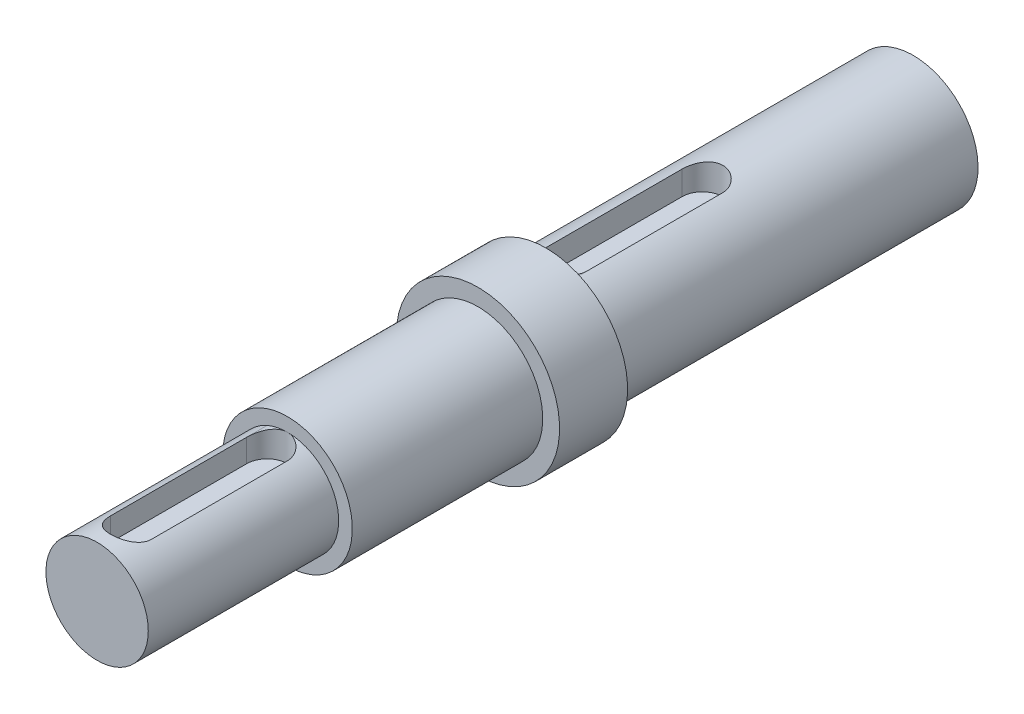
from build123d import *

# Parameters (mm, degrees)
SKETCH1_R               = 3.7625
PART1_DEPTH             = 14
SKETCH3_W               = 3
SKETCH3_H               = 4
KEYWAY1_DEPTH           = 13
SKETCH4_R               = 4.7625
PART2_BALLBEARING_DEPTH = 14
KEYWAY1_A_R             = 1.5
KEYWAY1_B_R             = 1.5
SKETCH6_R               = 6
PART3_DEPTH             = 5
SKETCH7_R               = 4.7625
PART4_DEPTH             = 13
SKETCH8_W               = 3
SKETCH8_H               = 4
KEYWAY2_DEPTH           = 13
SKETCH9_R               = 4.7625
PART5_BALLBEARING_DEPTH = 14
FILLET1_R               = 1.5
FILLET2_R               = 1.5


# Some blends are built 0.0001 mm under size
with BuildPart() as part:
    # Sketch1 → Part1 (new body)
    with BuildSketch(Plane.XY):
        Circle(SKETCH1_R)
    extrude(amount=PART1_DEPTH)

    # Sketch3 → Keyway1 (cut)
    with BuildSketch(Plane(origin=(0, 0, 0), x_dir=(-1, 0, 0), z_dir=(0, 0, -1))):
        with Locations((0, 3.7625)):
            Rectangle(SKETCH3_W, SKETCH3_H)
    extrude(amount=-KEYWAY1_DEPTH, mode=Mode.SUBTRACT)

    # Sketch4 → Part2_BallBearing (add)
    with BuildSketch(Plane(origin=(0, 0, 0), x_dir=(-1, 0, 0), z_dir=(0, 0, -1))):
        Circle(SKETCH4_R)
    extrude(amount=PART2_BALLBEARING_DEPTH)

    # Keyway1_a
    # the kernel refuses this fillet: 1.5 mm, written as the material it adds along each edge
    with BuildSketch(Plane(origin=(1.5, -1.9875, 0), x_dir=(-1, 0, 0), z_dir=(0, 1, 0))) as keyway1_a_piece_1_section:
        with BuildLine():
            CenterArc((KEYWAY1_A_R, KEYWAY1_A_R), KEYWAY1_A_R, 180, 90)
            Line((0, KEYWAY1_A_R), (0, 0))
            Line((0, 0), (KEYWAY1_A_R, 0))
        make_face()
    keyway1_a_piece_1 = extrude(amount=9.188066, mode=Mode.PRIVATE)
    keyway1_a_piece_1 = keyway1_a_piece_1 & Plane(origin=(0, 0, 0.327266), x_dir=(1, 0, 0), z_dir=(0, 0, -1)) * Cylinder(3.7625, 25, mode=Mode.PRIVATE)
    add(keyway1_a_piece_1)
    with BuildSketch(Plane(origin=(-1.5, 7.200566, 0), x_dir=(1, 0, 0), z_dir=(0, -1, 0))) as keyway1_a_piece_2_section:
        with BuildLine():
            CenterArc((KEYWAY1_A_R, KEYWAY1_A_R), KEYWAY1_A_R, 180, 90)
            Line((0, KEYWAY1_A_R), (0, 0))
            Line((0, 0), (KEYWAY1_A_R, 0))
        make_face()
    keyway1_a_piece_2 = extrude(amount=9.188066, mode=Mode.PRIVATE)
    keyway1_a_piece_2 = keyway1_a_piece_2 & Plane(origin=(0, 0, 0.327266), x_dir=(1, 0, 0), z_dir=(0, 0, -1)) * Cylinder(3.7625, 25, mode=Mode.PRIVATE)
    add(keyway1_a_piece_2)

    # Keyway1_b
    keyway1_b_edges = [part.edges().sort_by_distance(p)[0] for p in [
        (1.5, 2.606533, 13),
        (-1.5, 2.606533, 13),
    ]]
    fillet(keyway1_b_edges, radius=KEYWAY1_B_R - 0.0001)  # a hair under: the kernel refuses the full size

    # Sketch6 → Part3 (add)
    with BuildSketch(Plane(origin=(0, 0, -14), x_dir=(-1, 0, 0), z_dir=(0, 0, -1))):
        Circle(SKETCH6_R)
    extrude(amount=PART3_DEPTH)

    # Sketch7 → Part4 (add)
    with BuildSketch(Plane(origin=(0, 0, -19), x_dir=(-1, 0, 0), z_dir=(0, 0, -1))):
        Circle(SKETCH7_R)
    extrude(amount=PART4_DEPTH)

    # Sketch8 → KeyWay2 (cut)
    with BuildSketch(Plane(origin=(0, 0, -32), x_dir=(-1, 0, 0), z_dir=(0, 0, -1))):
        with Locations((0, 4.7625)):
            Rectangle(SKETCH8_W, SKETCH8_H)
    extrude(amount=-KEYWAY2_DEPTH, mode=Mode.SUBTRACT)

    # Sketch9 → Part5__BallBearing (add)
    with BuildSketch(Plane(origin=(0, 0, -32), x_dir=(-1, 0, 0), z_dir=(0, 0, -1))):
        Circle(SKETCH9_R)
    extrude(amount=PART5_BALLBEARING_DEPTH)

    # Fillet1
    # the kernel refuses this fillet: 1.5 mm, written as the material it adds along each edge
    with BuildSketch(Plane(origin=(1.5, -0.9875, -19), x_dir=(-1, 0, 0), z_dir=(0, 1, 0))) as fillet1_piece_1_section:
        with BuildLine():
            CenterArc((FILLET1_R, -FILLET1_R), FILLET1_R, 90, 90)
            Line((0, -FILLET1_R), (0, 0))
            Line((0, 0), (FILLET1_R, 0))
        make_face()
    fillet1_piece_1 = extrude(amount=9.257611, mode=Mode.PRIVATE)
    fillet1_piece_1 = fillet1_piece_1 & Plane(origin=(0, 0, -19.329162), x_dir=(-1, 0, 0), z_dir=(0, 0, 1)) * Cylinder(4.7625, 25, mode=Mode.PRIVATE)
    add(fillet1_piece_1)
    with BuildSketch(Plane(origin=(-1.5, 8.270111, -19), x_dir=(1, 0, 0), z_dir=(0, -1, 0))) as fillet1_piece_2_section:
        with BuildLine():
            CenterArc((FILLET1_R, -FILLET1_R), FILLET1_R, 90, 90)
            Line((0, -FILLET1_R), (0, 0))
            Line((0, 0), (FILLET1_R, 0))
        make_face()
    fillet1_piece_2 = extrude(amount=9.257611, mode=Mode.PRIVATE)
    fillet1_piece_2 = fillet1_piece_2 & Plane(origin=(0, 0, -19.329163), x_dir=(-1, 0, 0), z_dir=(0, 0, 1)) * Cylinder(4.7625, 25, mode=Mode.PRIVATE)
    add(fillet1_piece_2)

    # Fillet2
    # the kernel refuses this fillet: 1.5 mm, written as the material it adds along each edge
    with BuildSketch(Plane(origin=(1.5, -0.9875, -32), x_dir=(-1, 0, 0), z_dir=(0, 1, 0))) as fillet2_piece_1_section:
        with BuildLine():
            CenterArc((FILLET2_R, FILLET2_R), FILLET2_R, 180, 90)
            Line((0, FILLET2_R), (0, 0))
            Line((0, 0), (FILLET2_R, 0))
        make_face()
    fillet2_piece_1 = extrude(amount=9.257611, mode=Mode.PRIVATE)
    fillet2_piece_1 = fillet2_piece_1 & Plane(origin=(0, 0, -31.660407), x_dir=(-1, 0, 0), z_dir=(0, 0, 1)) * Cylinder(4.7625, 25, mode=Mode.PRIVATE)
    add(fillet2_piece_1)
    with BuildSketch(Plane(origin=(-1.5, 8.270111, -32), x_dir=(0, 0, 1), z_dir=(0, -1, 0))) as fillet2_piece_2_section:
        with BuildLine():
            CenterArc((FILLET2_R, -FILLET2_R), FILLET2_R, 90, 90)
            Line((0, -FILLET2_R), (0, 0))
            Line((0, 0), (FILLET2_R, 0))
        make_face()
    fillet2_piece_2 = extrude(amount=9.257611, mode=Mode.PRIVATE)
    fillet2_piece_2 = fillet2_piece_2 & Plane(origin=(0, 0, -31.668087), x_dir=(-1, 0, 0), z_dir=(0, 0, 1)) * Cylinder(4.7625, 25, mode=Mode.PRIVATE)
    add(fillet2_piece_2)


solid = part.part
